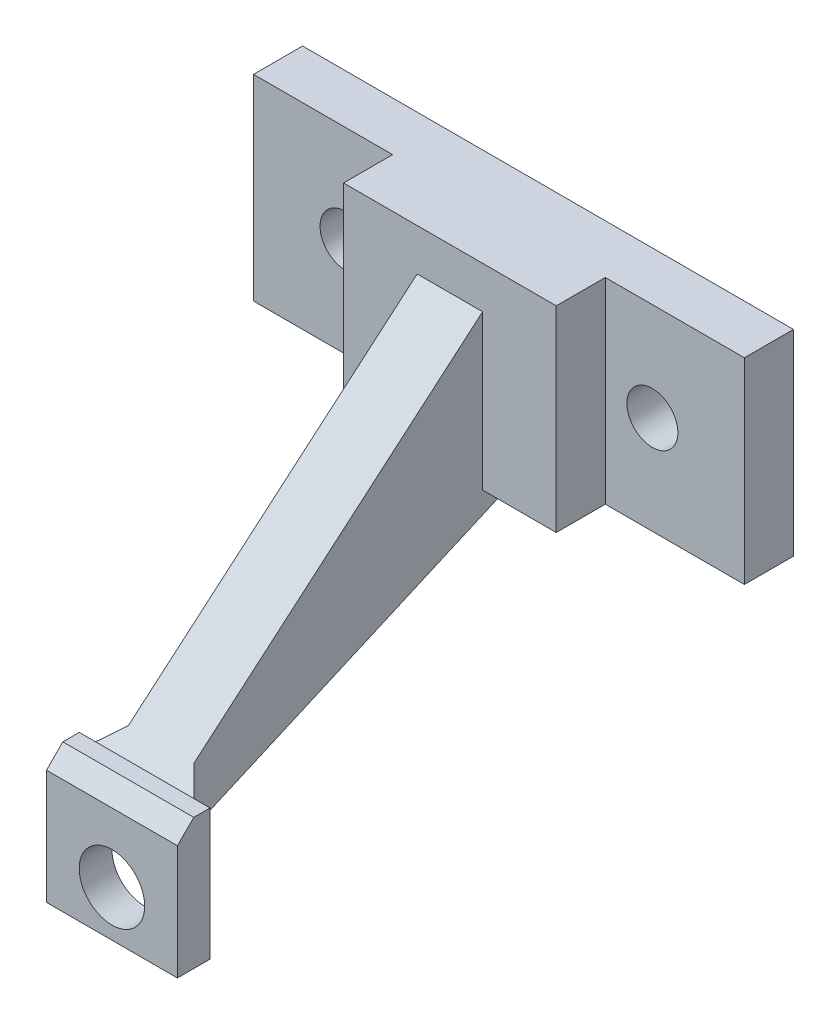
from build123d import *

# Parameters (mm, degrees)
SKETCH_1_W           = 30
SKETCH_1_H           = 12
SKETCH_1_R           = 1.56
EXTRUDE_1_DEPTH      = 3
SKETCH_2_W           = 13
SKETCH_2_H           = 12
EXTRUDE_2_DEPTH      = 3
EXTRUDE_3_DEPTH      = 2
EXTRUDE_3_DEPTH_BACK = 2
SKETCH_8_W           = 8
SKETCH_8_H           = 8
SKETCH_8_R           = 2
EXTRUDE_4_DEPTH      = 2
CHAMFER_3_SIZE       = 1.945839098
CHAMFER_3_SIZE_2     = 1
CHAMFER_6_SIZE       = 1


with BuildPart() as part:
    # 草图1 → 凸台-拉伸1 (new body)
    with BuildSketch(Plane.XY):
        with Locations((15, 6)):
            Rectangle(SKETCH_1_W, SKETCH_1_H)
        with Locations((5.625, 6)):
            Circle(SKETCH_1_R, mode=Mode.SUBTRACT)
        with Locations((24.375, 6)):
            Circle(SKETCH_1_R, mode=Mode.SUBTRACT)
    extrude(amount=EXTRUDE_1_DEPTH)

    # 草图2 → 凸台-拉伸2 (add)
    with BuildSketch(Plane.XY.offset(3)):
        with Locations((15, 6)):
            Rectangle(SKETCH_2_W, SKETCH_2_H)
    extrude(amount=EXTRUDE_2_DEPTH)

    # 草图4 → 凸台-拉伸3 (add, two sides: drawn at the far end of the back side and taken through both)
    with BuildSketch(Plane(origin=(15, 0, 0), x_dir=(0, 0, -1), z_dir=(1, 0, 0)).offset(-EXTRUDE_3_DEPTH_BACK)):
        Polygon((-3, 0), (-24.650635095, -9.5), (-24.650635095, -6.5), (-3, 12), (-3, 6), align=None)
    extrude(amount=EXTRUDE_3_DEPTH + EXTRUDE_3_DEPTH_BACK)

    # 草图8 → 凸台-拉伸4 (add)
    with BuildSketch(Plane.XY.offset(24.650635095)):
        with Locations((15, -10.5)):
            Rectangle(SKETCH_8_W, SKETCH_8_H)
        with Locations((15, -11.7)):
            Circle(SKETCH_8_R, mode=Mode.SUBTRACT)
    extrude(amount=EXTRUDE_4_DEPTH)

    # 倒角3
    # the kernel refuses this chamfer: 1.945839098, 1 mm, written as the material it adds along each edge
    with BuildSketch(Plane(origin=(17, -9.5, 24.650635095), x_dir=(0, -0.9999018246669207, 0.014012174269630025), z_dir=(-1, 0, 0))) as chamfer_3_piece_1_section:
        Polygon((CHAMFER_3_SIZE * 0.999901824771, -CHAMFER_3_SIZE * 0.0140121742711), (-CHAMFER_3_SIZE_2 * 0.414599028562, -CHAMFER_3_SIZE_2 * 0.910004200823), (0, 0), align=None)
    chamfer_3_piece_1 = extrude(amount=4, mode=Mode.PRIVATE)
    chamfer_3_piece_1 = chamfer_3_piece_1 - Plane(origin=(15, -11.7, 24.270363883), x_dir=(1, 0, 0), z_dir=(0, 0, -1)) * Cylinder(2, 16, mode=Mode.PRIVATE)
    add(chamfer_3_piece_1)
    # the kernel refuses this chamfer: 1.945839098, 1 mm, written as the material it adds along each edge
    with BuildSketch(Plane(origin=(17, -14.017522086, 24.650635095), x_dir=(-0.027495876610585647, 0, -0.9996219169112968), z_dir=(0, 1, 0))) as chamfer_3_2_piece_1_section:
        Polygon((CHAMFER_3_SIZE_2 * 0.999621916911, -CHAMFER_3_SIZE_2 * 0.0274958766106), (-CHAMFER_3_SIZE_2 * 0.0274958766106, -CHAMFER_3_SIZE_2 * 0.999621916911), (0, 0), align=None)
    chamfer_3_2_piece_1 = extrude(amount=7.517522086, mode=Mode.PRIVATE)
    chamfer_3_2_piece_1 = split(chamfer_3_2_piece_1, bisect_by=Plane(origin=(17.387306177, -10.236604408, 24.178960298), z_dir=(0, 0.3633942713145685, 0.9316354456415631)), keep=Keep.TOP, mode=Mode.PRIVATE)
    chamfer_3_2_piece_1 = split(chamfer_3_2_piece_1, bisect_by=Plane(origin=(17.387306177, -9.521448323, 24.699516127), z_dir=(0, -0.9157242946977782, -0.4018071877160198)), keep=Keep.TOP, mode=Mode.PRIVATE)
    add(chamfer_3_2_piece_1)
    with BuildSketch(Plane(origin=(17, -14.017522086, 24.650635095), x_dir=(-0.027495876610585647, 0, -0.9996219169112968), z_dir=(0, 1, 0))) as chamfer_3_2_piece_2_section:
        Polygon((CHAMFER_3_SIZE_2 * 0.999621916911, -CHAMFER_3_SIZE_2 * 0.0274958766106), (-CHAMFER_3_SIZE_2 * 0.0274958766106, -CHAMFER_3_SIZE_2 * 0.999621916911), (0, 0), align=None)
    chamfer_3_2_piece_2 = extrude(amount=7.517522086, mode=Mode.PRIVATE)
    chamfer_3_2_piece_2 = split(chamfer_3_2_piece_2, bisect_by=Plane(origin=(16.988383788, -8.994550798, 23.694484135), z_dir=(0, -0.3633942713145685, -0.9316354456415631)), keep=Keep.TOP, mode=Mode.PRIVATE)
    chamfer_3_2_piece_2 = split(chamfer_3_2_piece_2, bisect_by=Plane(origin=(16.988383788, -9.059659256, 23.647092278), z_dir=(0, 0.9157242946977782, 0.4018071877160198)), keep=Keep.TOP, mode=Mode.PRIVATE)
    add(chamfer_3_2_piece_2)
    with BuildSketch(Plane(origin=(17, -14.017522086, 24.650635095), x_dir=(-0.027495876610585647, 0, -0.9996219169112968), z_dir=(0, 1, 0))) as chamfer_3_2_piece_3_section:
        Polygon((CHAMFER_3_SIZE_2 * 0.999621916911, -CHAMFER_3_SIZE_2 * 0.0274958766106), (-CHAMFER_3_SIZE_2 * 0.0274958766106, -CHAMFER_3_SIZE_2 * 0.999621916911), (0, 0), align=None)
    chamfer_3_2_piece_3 = extrude(amount=7.517522086, mode=Mode.PRIVATE)
    chamfer_3_2_piece_3 = split(chamfer_3_2_piece_3, bisect_by=Plane(origin=(17.33510096, -8.285636608, 23.417964648), z_dir=(0, 0.3633942713145685, 0.9316354456415631)), keep=Keep.TOP, mode=Mode.PRIVATE)
    chamfer_3_2_piece_3 = split(chamfer_3_2_piece_3, bisect_by=Plane(origin=(17.33510096, -9.12878782, 23.804637257), z_dir=(0, 0.9157242946977782, 0.4018071877160198)), keep=Keep.TOP, mode=Mode.PRIVATE)
    chamfer_3_2_piece_3 = split(chamfer_3_2_piece_3, bisect_by=Plane(origin=(17.33510096, -6.945348717, 25.171828747), z_dir=(0, -0.7602566248543531, -0.649622863179143)), keep=Keep.TOP, mode=Mode.PRIVATE)
    add(chamfer_3_2_piece_3)
    with BuildSketch(Plane(origin=(17, -14.017522086, 24.650635095), x_dir=(-0.027495876610585647, 0, -0.9996219169112968), z_dir=(0, 1, 0))) as chamfer_3_2_piece_4_section:
        Polygon((CHAMFER_3_SIZE_2 * 0.999621916911, -CHAMFER_3_SIZE_2 * 0.0274958766106), (-CHAMFER_3_SIZE_2 * 0.0274958766106, -CHAMFER_3_SIZE_2 * 0.999621916911), (0, 0), align=None)
    chamfer_3_2_piece_4 = extrude(amount=10.089205074, mode=Mode.PRIVATE)
    chamfer_3_2_piece_4 = split(chamfer_3_2_piece_4, bisect_by=Plane(origin=(17.227791028, -6.5, 24.129350329), z_dir=(0, 1, 0)), keep=Keep.TOP, mode=Mode.PRIVATE)
    chamfer_3_2_piece_4 = split(chamfer_3_2_piece_4, bisect_by=Plane(origin=(17.227791028, -6.148560632, 24.239343986), z_dir=(0, -0.7602566248543531, -0.649622863179143)), keep=Keep.TOP, mode=Mode.PRIVATE)
    add(chamfer_3_2_piece_4)
    with BuildSketch(Plane(origin=(13, -3.928317012, 24.650635095), x_dir=(0.027495876610585647, 0, -0.9996219169112968), z_dir=(0, -1, 0))) as chamfer_3_2_piece_5_section:
        Polygon((CHAMFER_3_SIZE_2 * 0.999621916911, -CHAMFER_3_SIZE_2 * 0.0274958766106), (-CHAMFER_3_SIZE_2 * 0.0274958766106, -CHAMFER_3_SIZE_2 * 0.999621916911), (0, 0), align=None)
    chamfer_3_2_piece_5 = extrude(amount=10.089205074, mode=Mode.PRIVATE)
    chamfer_3_2_piece_5 = split(chamfer_3_2_piece_5, bisect_by=Plane(origin=(12.772208972, -6.5, 24.129350329), z_dir=(0, 1, 0)), keep=Keep.TOP, mode=Mode.PRIVATE)
    chamfer_3_2_piece_5 = split(chamfer_3_2_piece_5, bisect_by=Plane(origin=(12.772208972, -6.148560632, 24.239343986), z_dir=(0, -0.7602566248543531, -0.649622863179143)), keep=Keep.TOP, mode=Mode.PRIVATE)
    add(chamfer_3_2_piece_5)
    with BuildSketch(Plane(origin=(13, -6.5, 24.650635095), x_dir=(0.027495876610585647, 0, -0.9996219169112968), z_dir=(0, -1, 0))) as chamfer_3_2_piece_6_section:
        Polygon((CHAMFER_3_SIZE_2 * 0.999621916911, -CHAMFER_3_SIZE_2 * 0.0274958766106), (-CHAMFER_3_SIZE_2 * 0.0274958766106, -CHAMFER_3_SIZE_2 * 0.999621916911), (0, 0), align=None)
    chamfer_3_2_piece_6 = extrude(amount=7.517522086, mode=Mode.PRIVATE)
    chamfer_3_2_piece_6 = split(chamfer_3_2_piece_6, bisect_by=Plane(origin=(12.66489904, -8.285636608, 23.417964648), z_dir=(0, 0.3633942713145685, 0.9316354456415631)), keep=Keep.TOP, mode=Mode.PRIVATE)
    chamfer_3_2_piece_6 = split(chamfer_3_2_piece_6, bisect_by=Plane(origin=(12.66489904, -9.12878782, 23.804637257), z_dir=(0, 0.9157242946977782, 0.4018071877160198)), keep=Keep.TOP, mode=Mode.PRIVATE)
    chamfer_3_2_piece_6 = split(chamfer_3_2_piece_6, bisect_by=Plane(origin=(12.66489904, -6.945348717, 25.171828747), z_dir=(0, -0.7602566248543531, -0.649622863179143)), keep=Keep.TOP, mode=Mode.PRIVATE)
    add(chamfer_3_2_piece_6)
    with BuildSketch(Plane(origin=(13, -6.5, 24.650635095), x_dir=(0.027495876610585647, 0, -0.9996219169112968), z_dir=(0, -1, 0))) as chamfer_3_2_piece_7_section:
        Polygon((CHAMFER_3_SIZE_2 * 0.999621916911, -CHAMFER_3_SIZE_2 * 0.0274958766106), (-CHAMFER_3_SIZE_2 * 0.0274958766106, -CHAMFER_3_SIZE_2 * 0.999621916911), (0, 0), align=None)
    chamfer_3_2_piece_7 = extrude(amount=7.517522086, mode=Mode.PRIVATE)
    chamfer_3_2_piece_7 = split(chamfer_3_2_piece_7, bisect_by=Plane(origin=(12.612693823, -10.236604408, 24.178960298), z_dir=(0, 0.3633942713145685, 0.9316354456415631)), keep=Keep.TOP, mode=Mode.PRIVATE)
    chamfer_3_2_piece_7 = split(chamfer_3_2_piece_7, bisect_by=Plane(origin=(12.612693823, -9.521448323, 24.699516127), z_dir=(0, -0.9157242946977782, -0.4018071877160198)), keep=Keep.TOP, mode=Mode.PRIVATE)
    add(chamfer_3_2_piece_7)
    with BuildSketch(Plane(origin=(13, -6.5, 24.650635095), x_dir=(0.027495876610585647, 0, -0.9996219169112968), z_dir=(0, -1, 0))) as chamfer_3_2_piece_8_section:
        Polygon((CHAMFER_3_SIZE_2 * 0.999621916911, -CHAMFER_3_SIZE_2 * 0.0274958766106), (-CHAMFER_3_SIZE_2 * 0.0274958766106, -CHAMFER_3_SIZE_2 * 0.999621916911), (0, 0), align=None)
    chamfer_3_2_piece_8 = extrude(amount=7.517522086, mode=Mode.PRIVATE)
    chamfer_3_2_piece_8 = split(chamfer_3_2_piece_8, bisect_by=Plane(origin=(13.011616212, -8.994550798, 23.694484135), z_dir=(0, -0.3633942713145685, -0.9316354456415631)), keep=Keep.TOP, mode=Mode.PRIVATE)
    chamfer_3_2_piece_8 = split(chamfer_3_2_piece_8, bisect_by=Plane(origin=(13.011616212, -9.059659256, 23.647092278), z_dir=(0, 0.9157242946977782, 0.4018071877160198)), keep=Keep.TOP, mode=Mode.PRIVATE)
    add(chamfer_3_2_piece_8)

    # 倒角6
    chamfer_6_edges = [part.edges().sort_by_distance(p)[0] for p in [
        (15, -6.5, 26.650635095),
    ]]
    chamfer(chamfer_6_edges, length=CHAMFER_6_SIZE)


solid = part.part
